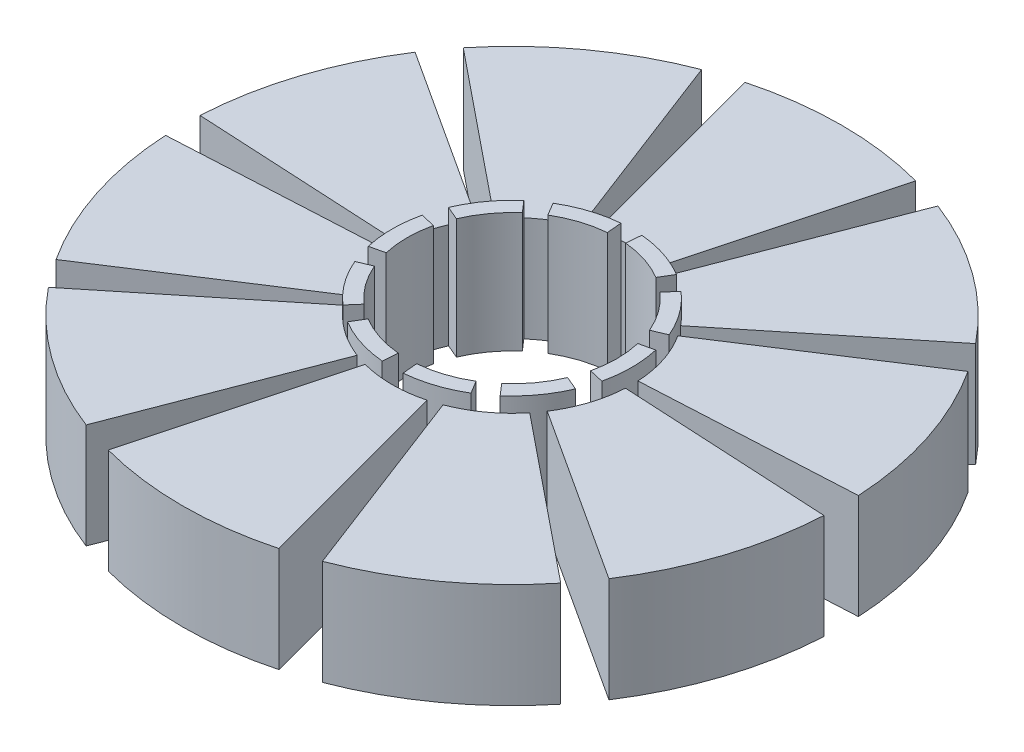
from build123d import *

# Parameters (mm, degrees)
BOSS_EXTRUDE1_DEPTH = 7
BOSS_EXTRUDE2_DEPTH = 1


with BuildPart() as part:
    # Sketch2 → Boss-Extrude1 (new body)
    with BuildSketch(Plane(origin=(0, 0, 0), x_dir=(1, 0, 0), z_dir=(0, 1, 0))):
        with BuildLine():
            ThreePointArc((5.694018992, 21.250368178), (0, 22), (-5.694018992, 21.250368178))
            Line((-5.694018992, 21.250368178), (-2.070552361, 7.72740661))
            ThreePointArc((-2.070552361, 7.72740661), (-2.472135955, 7.60845213), (-2.866943596, 7.468643412))
            Line((-2.866943596, 7.468643412), (-7.88409489, 20.538769383))
            ThreePointArc((-7.88409489, 20.538769383), (-12.93127555, 17.798373876), (-17.097211152, 13.845048603))
            Line((-17.097211152, 13.845048603), (-6.217167692, 5.034563128))
            ThreePointArc((-6.217167692, 5.034563128), (-6.472135955, 4.702282018), (-6.709364544, 4.35711228))
            Line((-6.709364544, 4.35711228), (-18.450752495, 11.98205877))
            ThreePointArc((-18.450752495, 11.98205877), (-20.923243358, 6.798373876), (-21.969849765, 1.151391037))
            Line((-21.969849765, 1.151391037), (-7.989036278, 0.41868765))
            ThreePointArc((-7.989036278, 0.41868765), (-8, 0), (-7.989036278, -0.41868765))
            Line((-7.989036278, -0.41868765), (-21.969849765, -1.151391037))
            ThreePointArc((-21.969849765, -1.151391037), (-20.923243358, -6.798373876), (-18.450752495, -11.98205877))
            Line((-18.450752495, -11.98205877), (-6.709364544, -4.35711228))
            ThreePointArc((-6.709364544, -4.35711228), (-6.472135955, -4.702282018), (-6.217167692, -5.034563128))
            Line((-6.217167692, -5.034563128), (-17.097211152, -13.845048603))
            ThreePointArc((-17.097211152, -13.845048603), (-12.93127555, -17.798373876), (-7.88409489, -20.538769383))
            Line((-7.88409489, -20.538769383), (-2.866943596, -7.468643412))
            ThreePointArc((-2.866943596, -7.468643412), (-2.472135955, -7.60845213), (-2.070552361, -7.72740661))
            Line((-2.070552361, -7.72740661), (-5.694018992, -21.250368178))
            ThreePointArc((-5.694018992, -21.250368178), (0, -22), (5.694018992, -21.250368178))
            Line((5.694018992, -21.250368178), (2.070552361, -7.72740661))
            ThreePointArc((2.070552361, -7.72740661), (2.472135955, -7.60845213), (2.866943596, -7.468643412))
            Line((2.866943596, -7.468643412), (7.88409489, -20.538769383))
            ThreePointArc((7.88409489, -20.538769383), (12.93127555, -17.798373876), (17.097211152, -13.845048603))
            Line((17.097211152, -13.845048603), (6.217167692, -5.034563128))
            ThreePointArc((6.217167692, -5.034563128), (6.472135955, -4.702282018), (6.709364544, -4.35711228))
            Line((6.709364544, -4.35711228), (18.450752495, -11.98205877))
            ThreePointArc((18.450752495, -11.98205877), (20.923243358, -6.798373876), (21.969849765, -1.151391037))
            Line((21.969849765, -1.151391037), (7.989036278, -0.41868765))
            ThreePointArc((7.989036278, -0.41868765), (8, 0), (7.989036278, 0.41868765))
            Line((7.989036278, 0.41868765), (21.969849765, 1.151391037))
            ThreePointArc((21.969849765, 1.151391037), (20.923243358, 6.798373876), (18.450752495, 11.98205877))
            Line((18.450752495, 11.98205877), (6.709364544, 4.35711228))
            ThreePointArc((6.709364544, 4.35711228), (6.472135955, 4.702282018), (6.217167692, 5.034563128))
            Line((6.217167692, 5.034563128), (17.097211152, 13.845048603))
            ThreePointArc((17.097211152, 13.845048603), (12.93127555, 17.798373876), (7.88409489, 20.538769383))
            Line((7.88409489, 20.538769383), (2.866943596, 7.468643412))
            ThreePointArc((2.866943596, 7.468643412), (2.472135955, 7.60845213), (2.070552361, 7.72740661))
            Line((2.070552361, 7.72740661), (5.694018992, 21.250368178))
        make_face()
        with BuildLine():
            Line((0.697245942, 7.969557585), (0.610090199, 6.973362887))
            ThreePointArc((0.610090199, 6.973362887), (1.215537244, 6.893654271), (1.811733316, 6.761480784))
            ThreePointArc((1.811733316, 6.761480784), (2.163118961, 6.657395614), (2.508575647, 6.535062985))
            ThreePointArc((2.508575647, 6.535062985), (3.068598028, 6.291558324), (3.605266524, 6.000171105))
            Line((3.605266524, 6.000171105), (4.120304599, 6.857338406))
            ThreePointArc((4.120304599, 6.857338406), (4.702282018, 6.472135955), (5.248472232, 6.037676642))
            Line((5.248472232, 6.037676642), (4.592413203, 5.282967062))
            ThreePointArc((4.592413203, 5.282967062), (5.035378602, 4.862608593), (5.44002173, 4.405242737))
            ThreePointArc((5.44002173, 4.405242737), (5.663118961, 4.114496766), (5.870693976, 3.812473245))
            ThreePointArc((5.870693976, 3.812473245), (6.18063315, 3.28630094), (6.443533974, 2.735117899))
            Line((6.443533974, 2.735117899), (7.364038828, 3.125849028))
            ThreePointArc((7.364038828, 3.125849028), (7.60845213, 2.472135955), (7.794960518, 1.799608435))
            Line((7.794960518, 1.799608435), (6.820590453, 1.57465738))
            ThreePointArc((6.820590453, 1.57465738), (6.931876481, 0.974211707), (6.990406743, 0.366351694))
            ThreePointArc((6.990406743, 0.366351694), (7, 0), (6.990406743, -0.366351694))
            ThreePointArc((6.990406743, -0.366351694), (6.931876481, -0.974211707), (6.820590453, -1.57465738))
            Line((6.820590453, -1.57465738), (7.794960518, -1.799608435))
            ThreePointArc((7.794960518, -1.799608435), (7.60845213, -2.472135955), (7.364038828, -3.125849028))
            Line((7.364038828, -3.125849028), (6.443533974, -2.735117899))
            ThreePointArc((6.443533974, -2.735117899), (6.18063315, -3.28630094), (5.870693976, -3.812473245))
            ThreePointArc((5.870693976, -3.812473245), (5.663118961, -4.114496766), (5.44002173, -4.405242737))
            ThreePointArc((5.44002173, -4.405242737), (5.035378602, -4.862608593), (4.592413203, -5.282967062))
            Line((4.592413203, -5.282967062), (5.248472232, -6.037676642))
            ThreePointArc((5.248472232, -6.037676642), (4.702282018, -6.472135955), (4.120304599, -6.857338406))
            Line((4.120304599, -6.857338406), (3.605266524, -6.000171105))
            ThreePointArc((3.605266524, -6.000171105), (3.068598028, -6.291558324), (2.508575647, -6.535062985))
            ThreePointArc((2.508575647, -6.535062985), (2.163118961, -6.657395614), (1.811733316, -6.761480784))
            ThreePointArc((1.811733316, -6.761480784), (1.215537244, -6.893654271), (0.610090199, -6.973362887))
            Line((0.610090199, -6.973362887), (0.697245942, -7.969557585))
            ThreePointArc((0.697245942, -7.969557585), (0, -8), (-0.697245942, -7.969557585))
            Line((-0.697245942, -7.969557585), (-0.610090199, -6.973362887))
            ThreePointArc((-0.610090199, -6.973362887), (-1.215537244, -6.893654271), (-1.811733316, -6.761480784))
            ThreePointArc((-1.811733316, -6.761480784), (-2.163118961, -6.657395614), (-2.508575647, -6.535062985))
            ThreePointArc((-2.508575647, -6.535062985), (-3.068598028, -6.291558324), (-3.605266524, -6.000171105))
            Line((-3.605266524, -6.000171105), (-4.120304599, -6.857338406))
            ThreePointArc((-4.120304599, -6.857338406), (-4.702282018, -6.472135955), (-5.248472232, -6.037676642))
            Line((-5.248472232, -6.037676642), (-4.592413203, -5.282967062))
            ThreePointArc((-4.592413203, -5.282967062), (-5.035378602, -4.862608593), (-5.44002173, -4.405242737))
            ThreePointArc((-5.44002173, -4.405242737), (-5.663118961, -4.114496766), (-5.870693976, -3.812473245))
            ThreePointArc((-5.870693976, -3.812473245), (-6.18063315, -3.28630094), (-6.443533974, -2.735117899))
            Line((-6.443533974, -2.735117899), (-7.364038828, -3.125849028))
            ThreePointArc((-7.364038828, -3.125849028), (-7.60845213, -2.472135955), (-7.794960518, -1.799608435))
            Line((-7.794960518, -1.799608435), (-6.820590453, -1.57465738))
            ThreePointArc((-6.820590453, -1.57465738), (-6.931876481, -0.974211707), (-6.990406743, -0.366351694))
            ThreePointArc((-6.990406743, -0.366351694), (-7, 0), (-6.990406743, 0.366351694))
            ThreePointArc((-6.990406743, 0.366351694), (-6.931876481, 0.974211707), (-6.820590453, 1.57465738))
            Line((-6.820590453, 1.57465738), (-7.794960518, 1.799608435))
            ThreePointArc((-7.794960518, 1.799608435), (-7.60845213, 2.472135955), (-7.364038828, 3.125849028))
            Line((-7.364038828, 3.125849028), (-6.443533974, 2.735117899))
            ThreePointArc((-6.443533974, 2.735117899), (-6.18063315, 3.28630094), (-5.870693976, 3.812473245))
            ThreePointArc((-5.870693976, 3.812473245), (-5.663118961, 4.114496766), (-5.44002173, 4.405242737))
            ThreePointArc((-5.44002173, 4.405242737), (-5.035378602, 4.862608593), (-4.592413203, 5.282967062))
            Line((-4.592413203, 5.282967062), (-5.248472232, 6.037676642))
            ThreePointArc((-5.248472232, 6.037676642), (-4.702282018, 6.472135955), (-4.120304599, 6.857338406))
            Line((-4.120304599, 6.857338406), (-3.605266524, 6.000171105))
            ThreePointArc((-3.605266524, 6.000171105), (-3.068598028, 6.291558324), (-2.508575647, 6.535062985))
            ThreePointArc((-2.508575647, 6.535062985), (-2.163118961, 6.657395614), (-1.811733316, 6.761480784))
            ThreePointArc((-1.811733316, 6.761480784), (-1.215537244, 6.893654271), (-0.610090199, 6.973362887))
            Line((-0.610090199, 6.973362887), (-0.697245942, 7.969557585))
            ThreePointArc((-0.697245942, 7.969557585), (0, 8), (0.697245942, 7.969557585))
        make_face(mode=Mode.SUBTRACT)
    extrude(amount=BOSS_EXTRUDE1_DEPTH)

    # Sketch3 → Boss-Extrude2 (add)
    with BuildSketch(Plane(origin=(0, 7, 0), x_dir=(1, 0, 0), z_dir=(0, 1, 0))):
        with BuildLine():
            Line((-7.794960518, 1.799608435), (-6.820590453, 1.57465738))
            ThreePointArc((-6.820590453, 1.57465738), (-7, 0), (-6.820590453, -1.57465738))
            Line((-6.820590453, -1.57465738), (-7.794960518, -1.799608435))
            ThreePointArc((-7.794960518, -1.799608435), (-8, 0), (-7.794960518, 1.799608435))
        make_face()
        with BuildLine():
            Line((-7.364038828, -3.125849028), (-6.443533974, -2.735117899))
            ThreePointArc((-6.443533974, -2.735117899), (-5.663118961, -4.114496766), (-4.592413203, -5.282967062))
            Line((-4.592413203, -5.282967062), (-5.248472232, -6.037676642))
            ThreePointArc((-5.248472232, -6.037676642), (-6.472135955, -4.702282018), (-7.364038828, -3.125849028))
        make_face()
        with BuildLine():
            Line((-4.120304599, -6.857338406), (-3.605266524, -6.000171105))
            ThreePointArc((-3.605266524, -6.000171105), (-2.163118961, -6.657395614), (-0.610090199, -6.973362887))
            Line((-0.610090199, -6.973362887), (-0.697245942, -7.969557585))
            ThreePointArc((-0.697245942, -7.969557585), (-2.472135955, -7.60845213), (-4.120304599, -6.857338406))
        make_face()
        with BuildLine():
            Line((0.697245942, -7.969557585), (0.610090199, -6.973362887))
            ThreePointArc((0.610090199, -6.973362887), (2.163118961, -6.657395614), (3.605266524, -6.000171105))
            Line((3.605266524, -6.000171105), (4.120304599, -6.857338406))
            ThreePointArc((4.120304599, -6.857338406), (2.472135955, -7.60845213), (0.697245942, -7.969557585))
        make_face()
        with BuildLine():
            Line((5.248472232, -6.037676642), (4.592413203, -5.282967062))
            ThreePointArc((4.592413203, -5.282967062), (5.663118961, -4.114496766), (6.443533974, -2.735117899))
            Line((6.443533974, -2.735117899), (7.364038828, -3.125849028))
            ThreePointArc((7.364038828, -3.125849028), (6.472135955, -4.702282018), (5.248472232, -6.037676642))
        make_face()
        with BuildLine():
            Line((7.794960518, -1.799608435), (6.820590453, -1.57465738))
            ThreePointArc((6.820590453, -1.57465738), (7, 0), (6.820590453, 1.57465738))
            Line((6.820590453, 1.57465738), (7.794960518, 1.799608435))
            ThreePointArc((7.794960518, 1.799608435), (8, 0), (7.794960518, -1.799608435))
        make_face()
        with BuildLine():
            Line((7.364038828, 3.125849028), (6.443533974, 2.735117899))
            ThreePointArc((6.443533974, 2.735117899), (5.663118961, 4.114496766), (4.592413203, 5.282967062))
            Line((4.592413203, 5.282967062), (5.248472232, 6.037676642))
            ThreePointArc((5.248472232, 6.037676642), (6.472135955, 4.702282018), (7.364038828, 3.125849028))
        make_face()
        with BuildLine():
            Line((4.120304599, 6.857338406), (3.605266524, 6.000171105))
            ThreePointArc((3.605266524, 6.000171105), (2.163118961, 6.657395614), (0.610090199, 6.973362887))
            Line((0.610090199, 6.973362887), (0.697245942, 7.969557585))
            ThreePointArc((0.697245942, 7.969557585), (2.472135955, 7.60845213), (4.120304599, 6.857338406))
        make_face()
        with BuildLine():
            Line((-0.697245942, 7.969557585), (-0.610090199, 6.973362887))
            ThreePointArc((-0.610090199, 6.973362887), (-2.163118961, 6.657395614), (-3.605266524, 6.000171105))
            Line((-3.605266524, 6.000171105), (-4.120304599, 6.857338406))
            ThreePointArc((-4.120304599, 6.857338406), (-2.472135955, 7.60845213), (-0.697245942, 7.969557585))
        make_face()
        with BuildLine():
            Line((-5.248472232, 6.037676642), (-4.592413203, 5.282967062))
            ThreePointArc((-4.592413203, 5.282967062), (-5.663118961, 4.114496766), (-6.443533974, 2.735117899))
            Line((-6.443533974, 2.735117899), (-7.364038828, 3.125849028))
            ThreePointArc((-7.364038828, 3.125849028), (-6.472135955, 4.702282018), (-5.248472232, 6.037676642))
        make_face()
    extrude(amount=BOSS_EXTRUDE2_DEPTH)


solid = part.part
